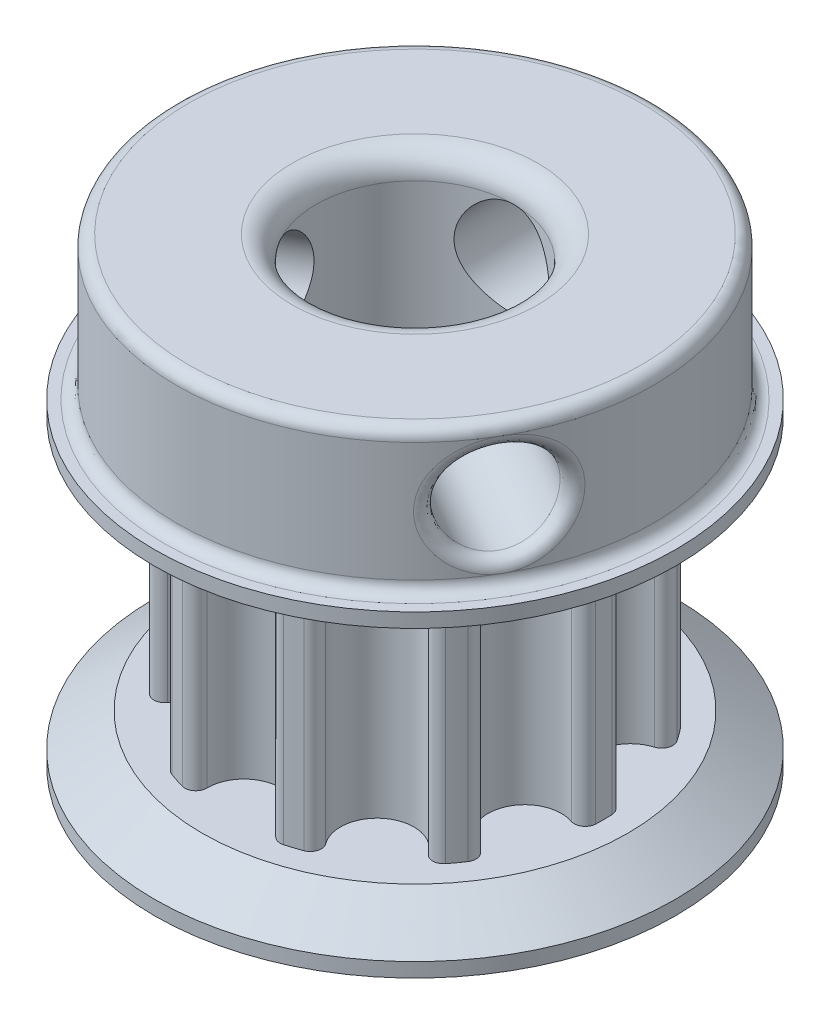
from build123d import *
from OCP.BRepFilletAPI import BRepFilletAPI_MakeChamfer

# Parameters (mm, degrees)
BOSS_EXTRU_1_DEPTH           = 9.3
R_P_TITION_CIRCULAIRE1_COUNT = 10
ESQUISSE2_R                  = 10.925130477
BOSS_EXTRU_2_DEPTH           = 2
CHANFREIN1_SIZE              = 2
CHANFREIN1_SIZE2             = 1.400415076
ESQUISSE4_R                  = 10
BOSS_EXTRU_3_DEPTH           = 6
ESQUISSE5_R                  = 2
ENL_V_MAT_EXTRU_2_DEPTH      = 24.194976867
R_P_TITION_CIRCULAIRE2_COUNT = 3
ENL_V_MAT_EXTRU_1_REACH      = 26.723
ESQUISSE3_R                  = 4.15
CONG_1_R                     = 1
CONG_2_R                     = 0.5


with BuildPart() as part:
    # Esquisse1 → Boss.-Extru.1 (new body)
    with BuildSketch(Plane(origin=(0, 0, 0), x_dir=(1, 0, 0), z_dir=(0, 1, 0))):
        with BuildLine():
            Line((0, 0), (-2.449, 7.537246983))
            ThreePointArc((-2.449, 7.537246983), (-2.286802769, 7.588031772), (-2.123553773, 7.635326611))
            ThreePointArc((-2.123553773, 7.635326611), (-1.721383845, 7.556942144), (-1.5428703, 7.188136381))
            ThreePointArc((-1.5428703, 7.188136381), (0, 5.625130477), (1.5428703, 7.188136381))
            ThreePointArc((1.5428703, 7.188136381), (1.721383845, 7.556942144), (2.123553773, 7.635326611))
            ThreePointArc((2.123553773, 7.635326611), (2.286802769, 7.588031772), (2.449, 7.537246983))
            Line((2.449, 7.537246983), (0, 0))
        make_face()
    boss_extru_1 = extrude(amount=BOSS_EXTRU_1_DEPTH)

    # Répétition circulaire1: Boss.-Extru.1 ×10 about axis
    r_p_tition_circulaire1_axis = Axis((0, 0, 0), (0, 1, 0))
    for i in range(1, R_P_TITION_CIRCULAIRE1_COUNT):
        add(boss_extru_1.rotate(r_p_tition_circulaire1_axis, i * 360 / R_P_TITION_CIRCULAIRE1_COUNT))

    # Esquisse2 → Boss.-Extru.2 (add)
    with BuildSketch(Plane(origin=(0, 9.3, 0), x_dir=(1, 0, 0), z_dir=(0, 1, 0))):
        with Locations(Location((0, 0, 0), (0, 0, 270))):
            Circle(ESQUISSE2_R)
    boss_extru_2 = extrude(amount=BOSS_EXTRU_2_DEPTH)

    # Symétrie1: Boss.-Extru.2 across plane
    add(boss_extru_2.mirror(Plane(origin=(0, 4.65, 0), x_dir=(0, 0, 1), z_dir=(0, -1, 0))))

    # Chanfrein1: one chamfer whose edges measure the first distance from different faces: ONE call of the kernel's chamfer builder (chamfer() names one face for all edges)
    chanfrein1_edges_1 = [part.edges().sort_by_distance(p)[0] for p in [
        (0, 9.3, -10.925130477),
    ]]
    chanfrein1_side_1 = [part.faces().sort_by_distance(p)[0] for p in [
        (0, 9.3, -10.616121123),
    ]]
    chanfrein1_edges_2 = [part.edges().sort_by_distance(p)[0] for p in [
        (0, 0, -10.925130477),
    ]]
    chanfrein1_side_2 = [part.faces().sort_by_distance(p)[0] for p in [
        (0, 0, -10.616121123),
    ]]
    chanfrein1 = BRepFilletAPI_MakeChamfer(part.part.solid().wrapped)
    for e in chanfrein1_edges_1:
        chanfrein1.Add(CHANFREIN1_SIZE, CHANFREIN1_SIZE2, e.wrapped, chanfrein1_side_1[0].wrapped)  # the first distance lies on this face
    for e in chanfrein1_edges_2:
        chanfrein1.Add(CHANFREIN1_SIZE, CHANFREIN1_SIZE2, e.wrapped, chanfrein1_side_2[0].wrapped)  # the first distance lies on this face
    add(Compound.cast(chanfrein1.Shape()), mode=Mode.REPLACE)

    # Esquisse4 → Boss.-Extru.3 (add)
    with BuildSketch(Plane(origin=(0, 11.3, 0), x_dir=(1, 0, 0), z_dir=(0, 1, 0))):
        with Locations(Location((0, 0, 0), (0, 0, 270))):
            Circle(ESQUISSE4_R)
    extrude(amount=BOSS_EXTRU_3_DEPTH)

    # Esquisse5 → Enlèv. mat.-Extru.2 (cut, through all)
    with BuildSketch(Plane.XY):
        with Locations((0, 14.3)):
            Circle(ESQUISSE5_R)
    enl_v_mat_extru_2 = extrude(amount=-ENL_V_MAT_EXTRU_2_DEPTH, mode=Mode.SUBTRACT)

    # Répétition circulaire2: Enlèv. mat.-Extru.2 ×3 about axis
    r_p_tition_circulaire2_axis = Axis((0, 17.3, 0), (0, -1, 0))
    for i in range(1, R_P_TITION_CIRCULAIRE2_COUNT):
        add(enl_v_mat_extru_2.rotate(r_p_tition_circulaire2_axis, i * 360 / R_P_TITION_CIRCULAIRE2_COUNT), mode=Mode.SUBTRACT)

    # Esquisse3 → Enlèv. mat.-Extru.1 (cut, up to next)
    with BuildSketch(Plane(origin=(0, 17.3, 0), x_dir=(1, 0, 0), z_dir=(0, 1, 0)), mode=Mode.PRIVATE) as enl_v_mat_extru_1_sk1:
        with Locations(Location((0, 0, 0), (0, 0, 270))):
            Circle(ESQUISSE3_R)
    enl_v_mat_extru_1_tool1 = extrude(enl_v_mat_extru_1_sk1.sketch, amount=-ENL_V_MAT_EXTRU_1_REACH, mode=Mode.PRIVATE) & part.part
    add(enl_v_mat_extru_1_tool1.solids().sort_by_distance((0, 17.3, 0))[0], mode=Mode.SUBTRACT)

    # Congé1
    cong_1_edges = [part.edges().sort_by_distance(p)[0] for p in [
        (0, -2, -4.15),
        (0, 17.3, -4.15),
    ]]
    fillet(cong_1_edges, radius=CONG_1_R - 0.0001)  # a hair under: the kernel refuses the full size

    # Congé2
    cong_2_edges = [part.edges().sort_by_distance(p)[0] for p in [
        (0, 11.3, -10),
        (0, 17.3, -10),
        (-1.999948182, 14.285599215, -9.797969551),
        (9.485275807, 14.308306644, 3.166945358),
        (-7.485293037, 14.308306644, 6.631017132),
    ]]
    fillet(cong_2_edges, radius=CONG_2_R - 0.0001)  # a hair under: the kernel refuses the full size


solid = part.part
